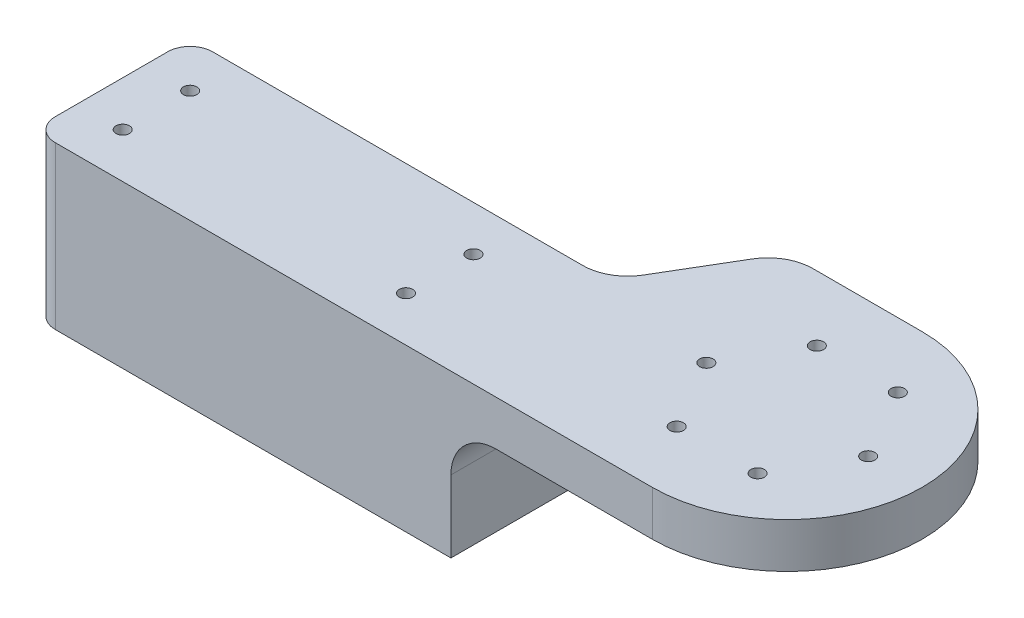
from build123d import *

# Parameters (mm, degrees)
SKETCH1_R           = 1.5
BOSS_EXTRUDE2_DEPTH = 10
BOSS_EXTRUDE3_START = -26
SKETCH1_3_R         = 1.5
BOSS_EXTRUDE3_DEPTH = 26
FILLET1_R           = 10


with BuildPart() as part:
    # Sketch1 → Boss-Extrude2 (new body)
    # profile 1 of 2: a face of its own
    with BuildSketch(Plane(origin=(0, 0, 0), x_dir=(-1, 0, 0), z_dir=(0, 1, 0))):
        with BuildLine():
            Line((0, 35), (-44.8, 35))
            ThreePointArc((-44.8, 35), (-74.8, 5), (-44.8, -25))
            Line((-44.8, -25), (-14.8, -25))
            Line((-14.8, -25), (0, 0))
            Line((0, 0), (0, 35))
        make_face()
        with Locations(Location((-53.8, -10.588457268, 0), (0, 0, 90))):
            Circle(SKETCH1_R, mode=Mode.SUBTRACT)
        with Locations(Location((-35.8, -10.588457268, 0), (0, 0, 90))):
            Circle(SKETCH1_R, mode=Mode.SUBTRACT)
        with Locations(Location((-26.8, 5, 0), (0, 0, 90))):
            Circle(SKETCH1_R, mode=Mode.SUBTRACT)
        with Locations(Location((-35.8, 20.588457268, 0), (0, 0, 90))):
            Circle(SKETCH1_R, mode=Mode.SUBTRACT)
        with Locations(Location((-53.8, 20.588457268, 0), (0, 0, 90))):
            Circle(SKETCH1_R, mode=Mode.SUBTRACT)
        with Locations(Location((-62.8, 5, 0), (0, 0, 90))):
            Circle(SKETCH1_R, mode=Mode.SUBTRACT)
    # profile 2 of 2: a face of its own
    with BuildSketch(Plane(origin=(0, 0, 0), x_dir=(-1, 0, 0), z_dir=(0, 1, 0))):
        with BuildLine():
            ThreePointArc((88, 35), (91.535533906, 33.535533906), (93, 30))
            Line((93, 30), (93, 5))
            ThreePointArc((93, 5), (91.535533906, 1.464466094), (88, 0))
            Line((88, 0), (0, 0))
            Line((0, 0), (0, 35))
            Line((0, 35), (88, 35))
        make_face()
        with Locations(Location((20, 10, 0), (0, 0, 90))):
            Circle(SKETCH1_R, mode=Mode.SUBTRACT)
        with Locations(Location((83, 10, 0), (0, 0, 90))):
            Circle(SKETCH1_R, mode=Mode.SUBTRACT)
        with Locations(Location((83, 25, 0), (0, 0, 90))):
            Circle(SKETCH1_R, mode=Mode.SUBTRACT)
        with Locations(Location((20, 25, 0), (0, 0, 90))):
            Circle(SKETCH1_R, mode=Mode.SUBTRACT)
    extrude(amount=BOSS_EXTRUDE2_DEPTH)

    # Sketch1<3> → Boss-Extrude3 (add)
    with BuildSketch(Plane(origin=(0, 0, 0), x_dir=(-1, 0, 0), z_dir=(0, 1, 0)).offset(BOSS_EXTRUDE3_START)):
        with BuildLine():
            ThreePointArc((88, 35), (91.535533906, 33.535533906), (93, 30))
            Line((93, 30), (93, 5))
            ThreePointArc((93, 5), (91.535533906, 1.464466094), (88, 0))
            Line((88, 0), (0, 0))
            Line((0, 0), (0, 35))
            Line((0, 35), (88, 35))
        make_face()
        with Locations(Location((20, 10, 0), (0, 0, 90))):
            Circle(SKETCH1_3_R, mode=Mode.SUBTRACT)
        with Locations(Location((83, 10, 0), (0, 0, 90))):
            Circle(SKETCH1_3_R, mode=Mode.SUBTRACT)
        with Locations(Location((83, 25, 0), (0, 0, 90))):
            Circle(SKETCH1_3_R, mode=Mode.SUBTRACT)
        with Locations(Location((20, 25, 0), (0, 0, 90))):
            Circle(SKETCH1_3_R, mode=Mode.SUBTRACT)
    extrude(amount=BOSS_EXTRUDE3_DEPTH)

    # Fillet1
    # the kernel refuses this fillet: 10 mm, written as the material it adds along each edge
    with BuildSketch(Plane(origin=(0, 0, -60), x_dir=(0, -1, 0), z_dir=(0, 0, 1))) as fillet1_piece_1_section:
        with BuildLine():
            CenterArc((FILLET1_R, FILLET1_R), FILLET1_R, 180, 90)
            Line((0, FILLET1_R), (-FILLET1_R * 0.02, FILLET1_R))
            Line((-FILLET1_R * 0.02, FILLET1_R), (-FILLET1_R * 0.02, -FILLET1_R * 0.02))
            Line((-FILLET1_R * 0.02, -FILLET1_R * 0.02), (FILLET1_R, -FILLET1_R * 0.02))
            Line((FILLET1_R, -FILLET1_R * 0.02), (FILLET1_R, 0))
        make_face()
    fillet1_piece_1 = extrude(amount=95, mode=Mode.PRIVATE)
    fillet1_piece_1 = split(fillet1_piece_1, bisect_by=Plane(origin=(4.301180518, -1.064725153, 0), z_dir=(0, 0, -1)), keep=Keep.TOP, mode=Mode.PRIVATE)
    fillet1_piece_1 = split(fillet1_piece_1, bisect_by=Plane(origin=(2.708698038, -1.064725153, -4.575503443), z_dir=(0.8605150974154716, 0, 0.509424937669959)), keep=Keep.TOP, mode=Mode.PRIVATE)
    add(fillet1_piece_1)
    with BuildSketch(Plane(origin=(0, 0, 0), x_dir=(0, -1, 0), z_dir=(0, 0, 1))) as fillet1_piece_2_section:
        with BuildLine():
            CenterArc((FILLET1_R, FILLET1_R), FILLET1_R, 180, 90)
            Line((0, FILLET1_R), (-FILLET1_R * 0.02, FILLET1_R))
            Line((-FILLET1_R * 0.02, FILLET1_R), (-FILLET1_R * 0.02, -FILLET1_R * 0.02))
            Line((-FILLET1_R * 0.02, -FILLET1_R * 0.02), (FILLET1_R, -FILLET1_R * 0.02))
            Line((FILLET1_R, -FILLET1_R * 0.02), (FILLET1_R, 0))
        make_face()
    fillet1_piece_2 = extrude(amount=35, mode=Mode.PRIVATE)
    fillet1_piece_2 = split(fillet1_piece_2, bisect_by=Plane(origin=(-7.086614588, -2.262932977, 11.97063275), z_dir=(0.8605150974154716, 0, 0.509424937669959)), keep=Keep.TOP, mode=Mode.PRIVATE)
    add(fillet1_piece_2)
    with BuildSketch(Plane(origin=(0, 0, 0), x_dir=(0, -1, 0), z_dir=(0, 0, 1))) as fillet1_piece_3_section:
        with BuildLine():
            CenterArc((FILLET1_R, FILLET1_R), FILLET1_R, 180, 90)
            Line((0, FILLET1_R), (-FILLET1_R * 0.02, FILLET1_R))
            Line((-FILLET1_R * 0.02, FILLET1_R), (-FILLET1_R * 0.02, -FILLET1_R * 0.02))
            Line((-FILLET1_R * 0.02, -FILLET1_R * 0.02), (FILLET1_R, -FILLET1_R * 0.02))
            Line((FILLET1_R, -FILLET1_R * 0.02), (FILLET1_R, 0))
        make_face()
    fillet1_piece_3 = extrude(amount=35, mode=Mode.PRIVATE)
    fillet1_piece_3 = split(fillet1_piece_3, bisect_by=Plane(origin=(-0.083967584, -4.9, 0.141837136), z_dir=(-0.8605150974154716, 0, -0.509424937669959)), keep=Keep.TOP, mode=Mode.PRIVATE)
    add(fillet1_piece_3)
    with BuildSketch(Plane(origin=(0, -34.205679631, 0), x_dir=(-1, 0, 0), z_dir=(0, 1, 0))) as fillet1_piece_4_section:
        with BuildLine():
            CenterArc((FILLET1_R * 0.570094660516, -FILLET1_R), FILLET1_R, 90, 59.374467281)
            Line((-FILLET1_R * 0.290420436899, -FILLET1_R * 0.49057506233), (-FILLET1_R * 0.307630738848, -FILLET1_R * 0.480386563577))
            Line((-FILLET1_R * 0.307630738848, -FILLET1_R * 0.480386563577), (-FILLET1_R * 0.0114018932103, FILLET1_R * 0.02))
            Line((-FILLET1_R * 0.0114018932103, FILLET1_R * 0.02), (FILLET1_R * 0.570094660516, FILLET1_R * 0.02))
            Line((FILLET1_R * 0.570094660516, FILLET1_R * 0.02), (FILLET1_R * 0.570094660516, 0))
        make_face()
    fillet1_piece_4 = extrude(amount=44.205679631, mode=Mode.PRIVATE)
    fillet1_piece_4 = split(fillet1_piece_4, bisect_by=Plane(origin=(0, -13, -0.363733484), z_dir=(-1, 0, 0)), keep=Keep.TOP, mode=Mode.PRIVATE)
    fillet1_piece_4 = split(fillet1_piece_4, bisect_by=Plane(origin=(-1.77482193, -26, -0.363733484), z_dir=(0, 1, 0)), keep=Keep.TOP, mode=Mode.PRIVATE)
    fillet1_piece_4 = split(fillet1_piece_4, bisect_by=Plane(origin=(-1.77482193, 0, -0.363733484), z_dir=(0, -1, 0)), keep=Keep.TOP, mode=Mode.PRIVATE)
    add(fillet1_piece_4)
    with BuildSketch(Plane(origin=(0, 0, 0), x_dir=(-1, 0, 0), z_dir=(0, 1, 0))) as fillet1_piece_5_section:
        with BuildLine():
            CenterArc((FILLET1_R * 0.570094660516, -FILLET1_R), FILLET1_R, 90, 59.374467281)
            Line((-FILLET1_R * 0.290420436899, -FILLET1_R * 0.49057506233), (-FILLET1_R * 0.307630738848, -FILLET1_R * 0.480386563577))
            Line((-FILLET1_R * 0.307630738848, -FILLET1_R * 0.480386563577), (-FILLET1_R * 0.0114018932103, FILLET1_R * 0.02))
            Line((-FILLET1_R * 0.0114018932103, FILLET1_R * 0.02), (FILLET1_R * 0.570094660516, FILLET1_R * 0.02))
            Line((FILLET1_R * 0.570094660516, FILLET1_R * 0.02), (FILLET1_R * 0.570094660516, 0))
        make_face()
    fillet1_piece_5 = extrude(amount=10, mode=Mode.PRIVATE)
    fillet1_piece_5 = split(fillet1_piece_5, bisect_by=Plane(origin=(0, 5, -0.363733484), z_dir=(-1, 0, 0)), keep=Keep.TOP, mode=Mode.PRIVATE)
    add(fillet1_piece_5)
    with BuildSketch(Plane(origin=(0, 0, 0), x_dir=(-1, 0, 0), z_dir=(0, 1, 0))) as fillet1_piece_6_section:
        with BuildLine():
            CenterArc((FILLET1_R * 0.570094660516, -FILLET1_R), FILLET1_R, 90, 59.374467281)
            Line((-FILLET1_R * 0.290420436899, -FILLET1_R * 0.49057506233), (-FILLET1_R * 0.307630738848, -FILLET1_R * 0.480386563577))
            Line((-FILLET1_R * 0.307630738848, -FILLET1_R * 0.480386563577), (-FILLET1_R * 0.0114018932103, FILLET1_R * 0.02))
            Line((-FILLET1_R * 0.0114018932103, FILLET1_R * 0.02), (FILLET1_R * 0.570094660516, FILLET1_R * 0.02))
            Line((FILLET1_R * 0.570094660516, FILLET1_R * 0.02), (FILLET1_R * 0.570094660516, 0))
        make_face()
    fillet1_piece_6 = extrude(amount=10, mode=Mode.PRIVATE)
    fillet1_piece_6 = split(fillet1_piece_6, bisect_by=Plane(origin=(0, 5, -2.053594733), z_dir=(1, 0, 0)), keep=Keep.TOP, mode=Mode.PRIVATE)
    add(fillet1_piece_6)
    with BuildSketch(Plane(origin=(0, -34.205679631, 0), x_dir=(-1, 0, 0), z_dir=(0, 1, 0))) as fillet1_piece_7a_section:
        with BuildLine():
            CenterArc((FILLET1_R * 0.570094660516, -FILLET1_R), FILLET1_R, 90, 59.374467281)
            Line((-FILLET1_R * 0.290420436899, -FILLET1_R * 0.49057506233), (-FILLET1_R * 0.307630738848, -FILLET1_R * 0.480386563577))
            Line((-FILLET1_R * 0.307630738848, -FILLET1_R * 0.480386563577), (-FILLET1_R * 0.0114018932103, FILLET1_R * 0.02))
            Line((-FILLET1_R * 0.0114018932103, FILLET1_R * 0.02), (FILLET1_R * 0.570094660516, FILLET1_R * 0.02))
            Line((FILLET1_R * 0.570094660516, FILLET1_R * 0.02), (FILLET1_R * 0.570094660516, 0))
        make_face()
    fillet1_piece_7a = extrude(amount=44.205679631, mode=Mode.PRIVATE)
    fillet1_piece_7a = split(fillet1_piece_7a, bisect_by=Plane(origin=(0, -13, -2.053594733), z_dir=(1, 0, 0)), keep=Keep.TOP, mode=Mode.PRIVATE)
    fillet1_piece_7a = split(fillet1_piece_7a, bisect_by=Plane(origin=(1.054652956, -26, -2.053594733), z_dir=(0, 1, 0)), keep=Keep.TOP, mode=Mode.PRIVATE)
    fillet1_piece_7a = split(fillet1_piece_7a, bisect_by=Plane(origin=(1.054652956, 0, -2.053594733), z_dir=(0, -1, 0)), keep=Keep.TOP, mode=Mode.PRIVATE)
    with BuildSketch(Plane(origin=(0, 0, -60), x_dir=(0, -1, 0), z_dir=(0, 0, 1))) as fillet1_piece_7b_section:
        with BuildLine():
            CenterArc((FILLET1_R, FILLET1_R), FILLET1_R, 180, 90)
            Line((0, FILLET1_R), (-FILLET1_R * 0.02, FILLET1_R))
            Line((-FILLET1_R * 0.02, FILLET1_R), (-FILLET1_R * 0.02, -FILLET1_R * 0.02))
            Line((-FILLET1_R * 0.02, -FILLET1_R * 0.02), (FILLET1_R, -FILLET1_R * 0.02))
            Line((FILLET1_R, -FILLET1_R * 0.02), (FILLET1_R, 0))
        make_face()
    fillet1_piece_7b = extrude(amount=95, mode=Mode.PRIVATE)
    fillet1_piece_7b = split(fillet1_piece_7b, bisect_by=Plane(origin=(2.124740403, -2.345898291, 0), z_dir=(0, 0, -1)), keep=Keep.TOP, mode=Mode.PRIVATE)
    fillet1_piece_7b = split(fillet1_piece_7b, bisect_by=Plane(origin=(14.492269712, -2.345898291, -24.480185325), z_dir=(-0.8605150974154716, 0, -0.509424937669959)), keep=Keep.TOP, mode=Mode.PRIVATE)
    fillet1_piece_7 = fillet1_piece_7a & fillet1_piece_7b
    add(fillet1_piece_7)
    # the kernel refuses this fillet: 10 mm, written as the material it takes off along each edge
    with BuildSketch(Plane(origin=(14.8, -34.205679631, -25), x_dir=(-0.5094249376699589, 0, 0.8605150974154715), z_dir=(0, 1, 0))) as fillet1_2_piece_1:
        with BuildLine():
            CenterArc((FILLET1_R * 0.570094660516, FILLET1_R), FILLET1_R, 210.625532719, 59.374467281)
            Line((-FILLET1_R * 0.290420436899, FILLET1_R * 0.49057506233), (-FILLET1_R * 0.307630738848, FILLET1_R * 0.480386563577))
            Line((-FILLET1_R * 0.307630738848, FILLET1_R * 0.480386563577), (-FILLET1_R * 0.0114018932103, -FILLET1_R * 0.02))
            Line((-FILLET1_R * 0.0114018932103, -FILLET1_R * 0.02), (FILLET1_R * 0.570094660516, -FILLET1_R * 0.02))
            Line((FILLET1_R * 0.570094660516, -FILLET1_R * 0.02), (FILLET1_R * 0.570094660516, 0))
        make_face()
    extrude(amount=78.411359262, mode=Mode.SUBTRACT)


solid = part.part
